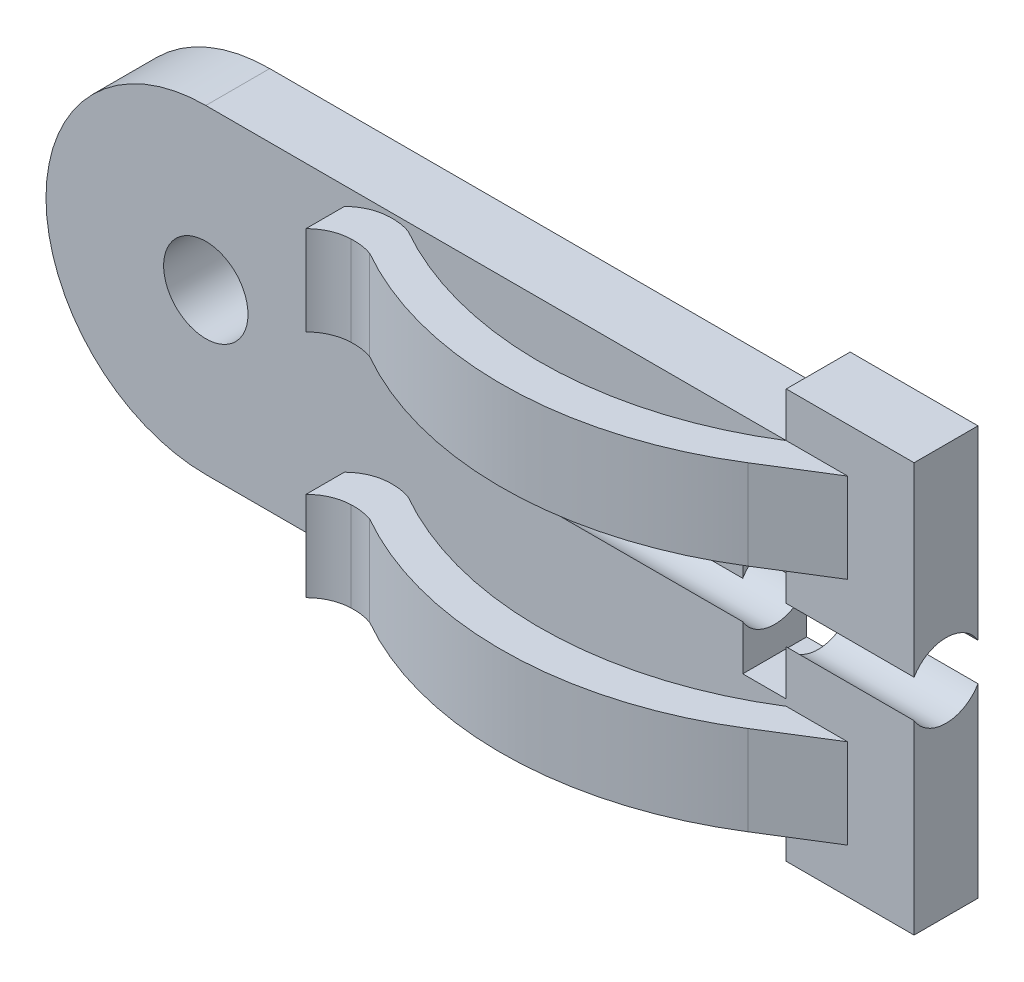
from build123d import *

# Parameters (mm, degrees)
SKETCH1_R           = 1.65
BOSS_EXTRUDE1_DEPTH = 2.5
SKETCH2_W           = 5
SKETCH2_H           = 16
BOSS_EXTRUDE2_DEPTH = 2.5
SKETCH3_W           = 1.7
SKETCH3_H           = 5
CUT_EXTRUDE1_DEPTH  = 29.940283343
SKETCH6_R           = 1.45
CUT_EXTRUDE3_DEPTH  = 16.7
BOSS_EXTRUDE3_DEPTH = 3.5
BOSS_EXTRUDE5_DEPTH = 3.5


with BuildPart() as part:
    # Sketch1 → Boss-Extrude1 (new body)
    with BuildSketch(Plane.XY):
        with BuildLine():
            ThreePointArc((0, 6.25), (-6.25, 0), (0, -6.25))
            Line((0, -6.25), (22.7, -6.25))
            Line((22.7, -6.25), (22.7, 6.25))
            Line((22.7, 6.25), (0, 6.25))
        make_face()
        Circle(SKETCH1_R, mode=Mode.SUBTRACT)
    extrude(amount=BOSS_EXTRUDE1_DEPTH)

    # Sketch2 → Boss-Extrude2 (add)
    with BuildSketch(Plane.XY.offset(2.5)):
        with Locations((25.2, 0)):
            Rectangle(SKETCH2_W, SKETCH2_H)
    extrude(amount=-BOSS_EXTRUDE2_DEPTH)

    # Sketch3 → Cut-Extrude1 (cut, through all)
    with BuildSketch(Plane.XY.offset(2.5)):
        with Locations((21.85, 0)):
            Rectangle(SKETCH3_W, SKETCH3_H)
    extrude(amount=-CUT_EXTRUDE1_DEPTH, mode=Mode.SUBTRACT)

    # Sketch6 → Cut-Extrude3 (cut)
    with BuildSketch(Plane(origin=(27.7, 0, 0), x_dir=(0, 0, -1), z_dir=(1, 0, 0))):
        with Locations((-1.25, 0)):
            Circle(SKETCH6_R)
    extrude(amount=-CUT_EXTRUDE3_DEPTH, mode=Mode.SUBTRACT)


with BuildPart() as body_2:
    # Sketch7 → Boss-Extrude3 (new body)
    with BuildSketch(Plane.XZ.offset(6.25)):
        with BuildLine():
            Line((6.129900512, 3.210673711), (6.129900512, 4.710673711))
            ThreePointArc((6.129900512, 4.710673711), (6.694341527, 4.327552018), (7.360579964, 4.180915603))
            ThreePointArc((7.360579964, 4.180915603), (7.789326283, 4.199870579), (8.206709695, 4.299739418))
            ThreePointArc((8.206709695, 4.299739418), (15.494742209, 6.151071465), (22.7, 4))
            Line((22.7, 4), (22.7, 2.5))
            ThreePointArc((22.7, 2.5), (15.494742209, 4.651071465), (8.206709695, 2.799739418))
            ThreePointArc((8.206709695, 2.799739418), (7.789326283, 2.699870579), (7.360579964, 2.680915603))
            ThreePointArc((7.360579964, 2.680915603), (6.694341527, 2.827552018), (6.129900512, 3.210673711))
        make_face()
    extrude(amount=-BOSS_EXTRUDE3_DEPTH)


with BuildPart() as body_3:
    # Sketch9 → Boss-Extrude5 (new body)
    with BuildSketch(Plane.XZ.offset(6.25)):
        Polygon((22.7, 4), (25.104907101, 2.5), (22.7, 2.5), align=None)
    extrude(amount=-BOSS_EXTRUDE5_DEPTH)

    # Combine1: union body 2
    add(body_2.part)


with BuildPart() as body_3_2:
    # Mirror5: mirrored copy
    add(body_3.part.mirror(Plane(origin=(0, 0, 0), x_dir=(0, 0, 1), z_dir=(0, -1, 0))))


solid = Compound([part.part, body_3.part, body_3_2.part])
